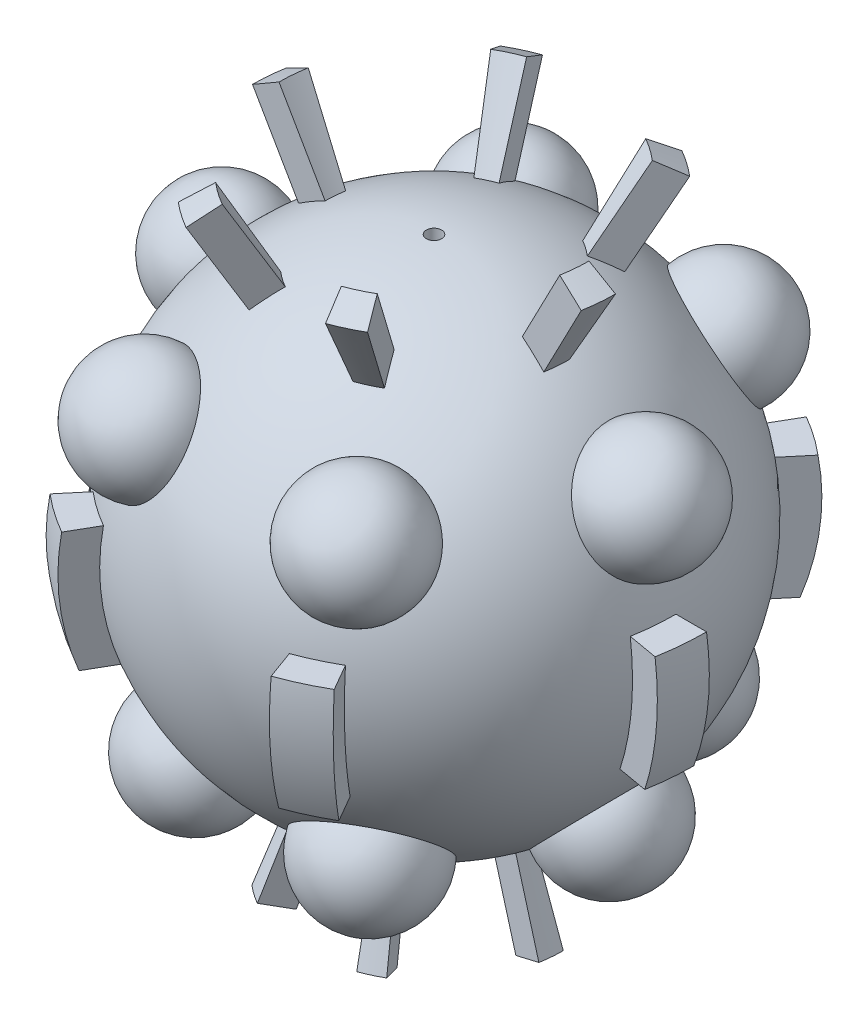
from build123d import *

# Parameters (mm, degrees)
CUT_EXTRUDE1_DEPTH      = 274.32
CUT_EXTRUDE1_DEPTH_BACK = 255.524
SKETCH2_R               = 6.35
REVOLVE2_ANGLE          = 10
CIRPATTERN1_COUNT       = 6


with BuildPart() as part:
    # Sketch1 → Revolve1 (revolve)
    with BuildSketch(Plane.XY):
        with BuildLine():
            Line((0, -203.2), (0, 203.2))
            ThreePointArc((0, 203.2), (-46.429689788, 197.82447752), (-90.402845706, 181.982321911))
            ThreePointArc((-90.402845706, 181.982321911), (-101.6, 175.976362049), (-112.399890962, 169.282321911))
            ThreePointArc((-112.399890962, 169.282321911), (-129.55435191, 156.543635774), (-145.276319497, 142.074033494))
            ThreePointArc((-145.276319497, 142.074033494), (-161.896133978, 122.800170208), (-175.976362049, 101.6))
            ThreePointArc((-175.976362049, 101.6), (-187.296133978, 78.806079695), (-195.677881973, 54.775966506))
            ThreePointArc((-195.677881973, 54.775966506), (-198.665103115, 42.689774003), (-200.906554809, 30.443328247))
            ThreePointArc((-200.906554809, 30.443328247), (-202.108634909, -21.031873321), (-190.333833211, -71.156671753))
            ThreePointArc((-190.333833211, -71.156671753), (-183.786530645, -86.676127933), (-175.976362049, -101.6))
            ThreePointArc((-175.976362049, -101.6), (-161.896133978, -122.800170208), (-145.276319497, -142.074033494))
            ThreePointArc((-145.276319497, -142.074033494), (-126.377625604, -159.119250082), (-105.496506977, -173.668439896))
            ThreePointArc((-105.496506977, -173.668439896), (-93.537806864, -180.391016093), (-81.152755482, -186.29135857))
            ThreePointArc((-81.152755482, -186.29135857), (-69.498493124, -190.945540544), (-57.5791597, -194.871445749))
            ThreePointArc((-57.5791597, -194.871445749), (-29.089192356, -201.107083138), (0, -203.2))
        make_face()
    revolve(axis=Axis((0, 203.2, 0), (0, -1, 0)))

    # Sketch2 → Cut-Extrude1 (cut, two sides: drawn at the far end of the back side and taken through both)
    with BuildSketch(Plane(origin=(0, 0, 0), x_dir=(1, 0, 0), z_dir=(0, 1, 0)).offset(-CUT_EXTRUDE1_DEPTH_BACK)):
        Circle(SKETCH2_R)
    extrude(amount=CUT_EXTRUDE1_DEPTH + CUT_EXTRUDE1_DEPTH_BACK, mode=Mode.SUBTRACT)

    # Sketch1<4> → Revolve2 (revolve)
    with BuildSketch(Plane.XY):
        with BuildLine():
            ThreePointArc((-112.399890962, 169.282321911), (-101.6, 175.976362049), (-90.402845706, 181.982321911))
            Line((-90.402845706, 181.982321911), (-128.701477372, 248.317497817))
            Line((-128.701477372, 248.317497817), (-150.698522628, 235.617497817))
            Line((-150.698522628, 235.617497817), (-112.399890962, 169.282321911))
        make_face()
        with BuildLine():
            Line((-83.776966683, -266.849328874), (-57.5791597, -194.871445749))
            ThreePointArc((-57.5791597, -194.871445749), (-69.498493124, -190.945540544), (-81.152755482, -186.29135857))
            Line((-81.152755482, -186.29135857), (-107.350562465, -258.269241695))
            Line((-107.350562465, -258.269241695), (-83.776966683, -266.849328874))
        make_face()
        with BuildLine():
            ThreePointArc((-190.333833211, -71.156671753), (-202.108634909, -21.031873321), (-200.906554809, 30.443328247))
            Line((-200.906554809, 30.443328247), (-226.306554809, 30.443328247))
            ThreePointArc((-226.306554809, 30.443328247), (-227.508634909, -21.031873321), (-215.733833211, -71.156671753))
            Line((-215.733833211, -71.156671753), (-190.333833211, -71.156671753))
        make_face()
    revolve2 = revolve(axis=Axis((0, 203.2, 0), (0, -1, 0)), revolution_arc=REVOLVE2_ANGLE)

    # Sketch1<6> → Revolve4 (revolve)
    with BuildSketch(Plane.XY):
        with BuildLine():
            ThreePointArc((-175.976362049, 101.6), (-161.896133978, 122.800170208), (-145.276319497, 142.074033494))
            ThreePointArc((-145.276319497, 142.074033494), (-186.025717712, 151.396088709), (-219.970452561, 127))
            Line((-219.970452561, 127), (-175.976362049, 101.6))
        make_face()
    revolve4 = revolve(axis=Axis((0, 0, 0), (-0.8660254037844364, 0.500000000000004, 0)))

    # Sketch1<11> → Revolve10 (revolve)
    with BuildSketch(Plane.XY):
        with BuildLine():
            Line((-181.595399371, -177.592541868), (-145.276319497, -142.074033494))
            ThreePointArc((-145.276319497, -142.074033494), (-161.896133978, -122.800170208), (-175.976362049, -101.6))
            ThreePointArc((-175.976362049, -101.6), (-195.938014076, -138.328008613), (-181.595399371, -177.592541868))
        make_face()
    revolve10 = revolve(axis=Axis((0, 0, 0), (-0.7149425172100239, -0.6991832357010533, 0)))

    # CirPattern1: Revolve2, Revolve4, Revolve10 ×6 about axis
    cirpattern1_axis = Axis((0, 0, 0), (0, 1, 0))
    add([revolve2.rotate(cirpattern1_axis, i * 360 / CIRPATTERN1_COUNT) for i in range(1, CIRPATTERN1_COUNT)])
    add([revolve4.rotate(cirpattern1_axis, i * 360 / CIRPATTERN1_COUNT) for i in range(1, CIRPATTERN1_COUNT)])
    add([revolve10.rotate(cirpattern1_axis, i * 360 / CIRPATTERN1_COUNT) for i in range(1, CIRPATTERN1_COUNT)])


solid = part.part
